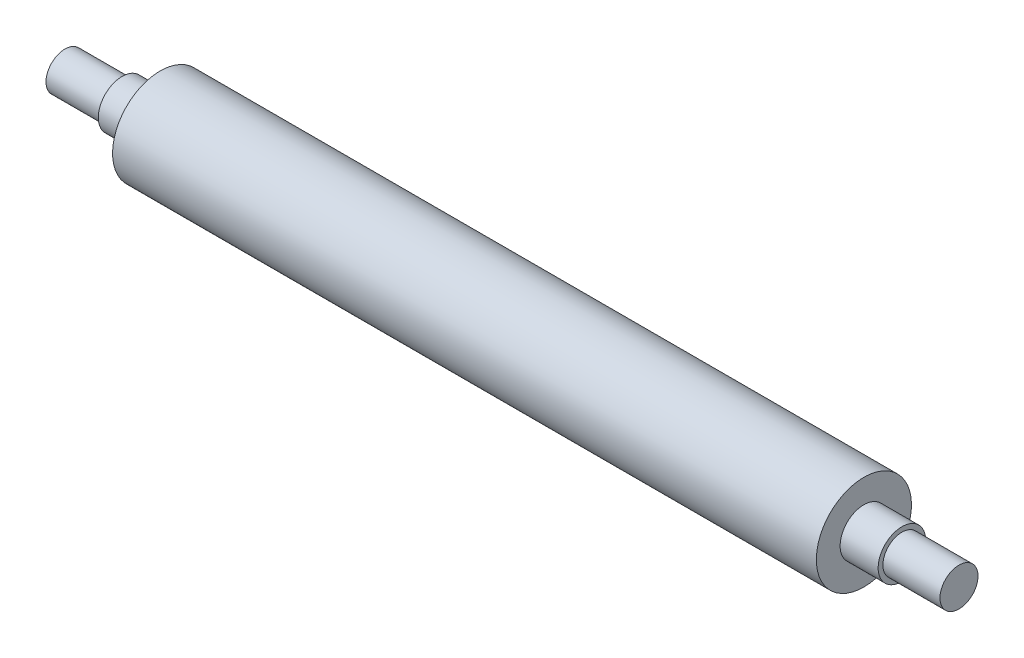
from build123d import *


with BuildPart() as part:
    # 草图1 → 旋转1 (revolve)
    with BuildSketch(Plane.XY):
        Polygon((-185, 25), (185, 25), (185, 12.5), (205, 12.5), (205, 10), (235, 10), (235, 0), (-235, 0), (-235, 10), (-205, 10), (-205, 12.5), (-185, 12.5), align=None)
    revolve(axis=Axis((-235, 0, 0), (1, 0, 0)))


solid = part.part
